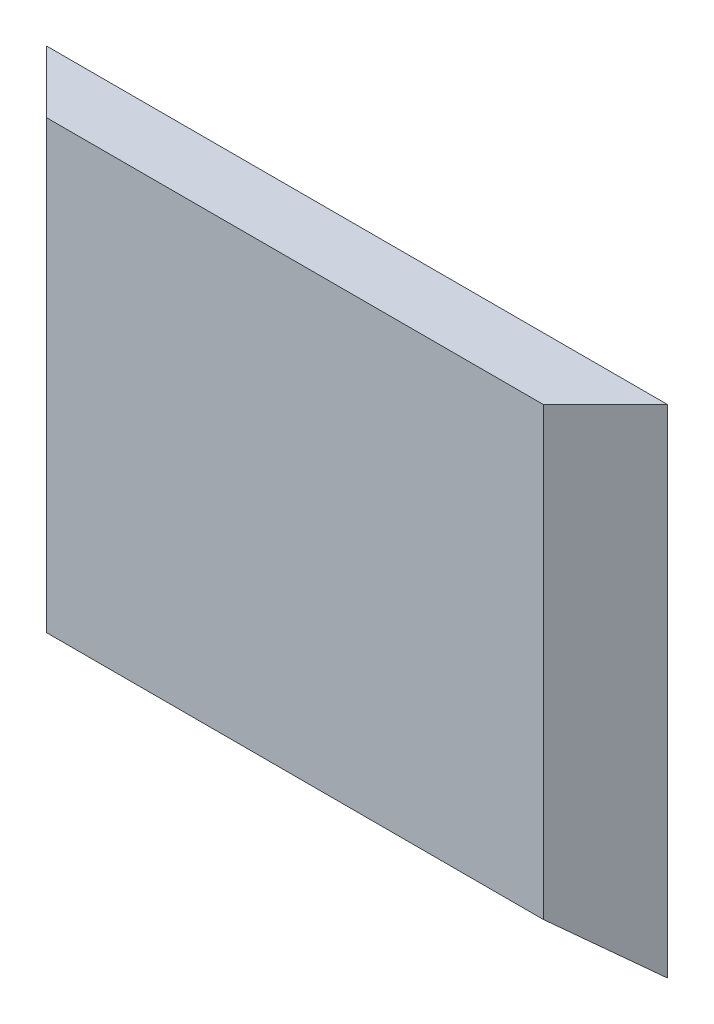
from build123d import *

# Parameters (mm, degrees)
SKETCH1_W               = 50
SKETCH1_H               = 40
BOSS_EXTRUDE1_DEPTH     = 5
CUT_EXTRUDE1_DEPTH      = 33.403703492
CUT_EXTRUDE1_DEPTH_BACK = 33.403703492
CUT_EXTRUDE2_DEPTH      = 33.403703492
CUT_EXTRUDE2_DEPTH_BACK = 33.403703492


with BuildPart() as part:
    # Sketch1 → Boss-Extrude1 (new body)
    with BuildSketch(Plane.XY):
        Rectangle(SKETCH1_W, SKETCH1_H)
    extrude(amount=BOSS_EXTRUDE1_DEPTH)

    # Sketch2 → Cut-Extrude1 (cut, two sides: drawn at the far end of the back side and taken through both)
    with BuildSketch(Plane(origin=(0, 0, 0), x_dir=(1, 0, 0), z_dir=(0, 1, 0)).offset(-CUT_EXTRUDE1_DEPTH_BACK)):
        Polygon((-25, 0), (-20, -5), (-25, -5), align=None)
        Polygon((25, 0), (20, -5), (25, -5), align=None)
    extrude(amount=CUT_EXTRUDE1_DEPTH + CUT_EXTRUDE1_DEPTH_BACK, mode=Mode.SUBTRACT)

    # Sketch3 → Cut-Extrude2 (cut, two sides: drawn at the far end of the back side and taken through both)
    with BuildSketch(Plane(origin=(0, 0, 0), x_dir=(0, 0, -1), z_dir=(1, 0, 0)).offset(-CUT_EXTRUDE2_DEPTH_BACK)):
        Polygon((0, -20), (-5, -15.916820135), (-5, -20), align=None)
    extrude(amount=CUT_EXTRUDE2_DEPTH + CUT_EXTRUDE2_DEPTH_BACK, mode=Mode.SUBTRACT)


solid = part.part
